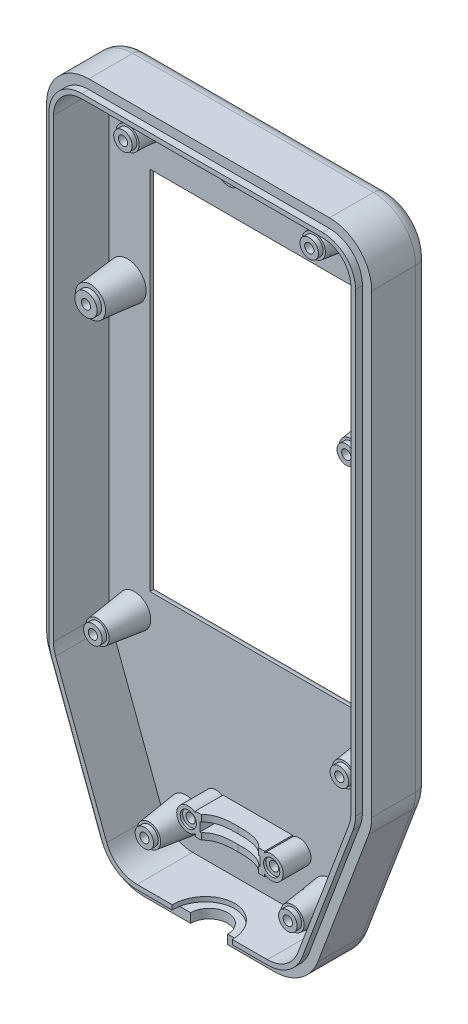
from build123d import *

# Parameters (mm, degrees)
SALIENTE_EXTRUIR1_DEPTH  = 12.5
CORTAR_EXTRUIR5_DEPTH    = 8
REDONDEO1_R              = 3
SALIENTE_EXTRUIR3_DEPTH  = 1.5
CORTAR_EXTRUIR27_DEPTH   = 12
CROQUIS70_R              = 3.5
CORTAR_EXTRUIR28_DEPTH   = 1
CROQUIS71_R              = 1.5
CORTAR_EXTRUIR29_DEPTH   = 5
CROQUIS72_R              = 5
CORTAR_EXTRUIR30_DEPTH   = 0.4
CROQUIS73_W              = 44
CROQUIS73_H              = 79
CORTAR_EXTRUIR31_DEPTH   = 105.505307201
REDONDEO2_R              = 2
CROQUIS78_R              = 2.5
CROQUIS74_3_R            = 3.5
CROQUIS79_R              = 2
SALIENTE_EXTRUIR5_DEPTH  = 1
CROQUIS80_R              = 1
CORTAR_EXTRUIR33_DEPTH   = 10
CROQUIS87_R              = 2
SALIENTE_EXTRUIR7_DEPTH  = 1
CROQUIS88_R              = 1
CORTAR_EXTRUIR35_DEPTH   = 10
CROQUIS89_R              = 2.5
CROQUIS74_6_R            = 3.5
CROQUIS90_R              = 2
SALIENTE_EXTRUIR8_DEPTH  = 1
CROQUIS92_R              = 1
CORTAR_EXTRUIR36_DEPTH   = 10
CROQUIS95_R              = 2.4
SALIENTE_EXTRUIR9_DEPTH  = 1
CROQUIS96_R              = 1
CORTAR_EXTRUIR37_DEPTH   = 10
CROQUIS97_R              = 4
CORTAR_EXTRUIR38_DEPTH   = 2
CROQUIS98_RX             = 7
CROQUIS98_RY             = 6.5
CORTAR_EXTRUIR39_DEPTH   = 2
CROQUIS99_W              = 7.5
CROQUIS99_H              = 4.8
SALIENTE_EXTRUIR10_DEPTH = 6
CROQUIS100_W             = 13
CROQUIS100_H             = 2
CORTAR_EXTRUIR40_DEPTH   = 6
CORTAR_EXTRUIR41_DEPTH   = 6
CROQUIS103_R             = 2.5
SALIENTE_EXTRUIR11_DEPTH = 6
CROQUIS104_R             = 1.75
CORTAR_EXTRUIR42_DEPTH   = 0.5
CROQUIS105_R             = 1
CORTAR_EXTRUIR43_DEPTH   = 6
CROQUIS108_R             = 2
SALIENTE_EXTRUIR12_DEPTH = 1
CROQUIS109_R             = 1
CORTAR_EXTRUIR44_DEPTH   = 10
CROQUIS112_R             = 2
SALIENTE_EXTRUIR13_DEPTH = 1
CROQUIS113_R             = 1
CORTAR_EXTRUIR45_DEPTH   = 10
CROQUIS117_R             = 1.5
CORTAR_EXTRUIR46_DEPTH   = 10
CROQUIS120_R             = 2
SALIENTE_EXTRUIR14_DEPTH = 1
CROQUIS122_R             = 1
CORTAR_EXTRUIR47_DEPTH   = 10
CROQUIS118_3_R           = 3.5
CROQUIS123_R             = 2.5
CROQUIS124_R             = 2
SALIENTE_EXTRUIR15_DEPTH = 1
CROQUIS125_R             = 1
CORTAR_EXTRUIR48_DEPTH   = 10


with BuildPart() as part:
    # Croquis1 → Saliente-Extruir1 (new body)
    with BuildSketch(Plane.XY):
        with BuildLine():
            Line((-22.155928994, 95.954885102), (29.844071006, 95.954885102))
            ThreePointArc((29.844071006, 95.954885102), (36.29125523, 93.284373958), (38.961766375, 86.837189734))
            Line((38.961766375, 86.837189734), (38.961766375, -11.692810266))
            ThreePointArc((38.961766375, -11.692810266), (38.800517726, -13.481377247), (38.321972006, -15.212263426))
            Line((38.321972006, -15.212263426), (27.285455785, -44.564568057))
            ThreePointArc((27.285455785, -44.564568057), (23.617590112, -49.266870537), (17.925250154, -51.045114898))
            Line((17.925250154, -51.045114898), (-10.229579438, -51.045114898))
            ThreePointArc((-10.229579438, -51.045114898), (-15.920892374, -49.267581503), (-19.588905549, -44.566906311))
            Line((-19.588905549, -44.566906311), (-30.632950472, -15.216838151))
            ThreePointArc((-30.632950472, -15.216838151), (-31.112152227, -13.484842661), (-31.273624362, -11.695046738))
            Line((-31.273624362, -11.695046738), (-31.273624362, 86.837189734))
            ThreePointArc((-31.273624362, 86.837189734), (-28.603113217, 93.284373958), (-22.155928994, 95.954885102))
        make_face()
    extrude(amount=SALIENTE_EXTRUIR1_DEPTH)

    # Croquis7 → Cortar-Extruir5 (cut)
    with BuildSketch(Plane.XY.offset(12.5)):
        with BuildLine():
            Line((29.844071006, 92.954885102), (-22.155928994, 92.954885102))
            ThreePointArc((-22.155928994, 92.954885102), (-26.481792874, 91.163053614), (-28.273624362, 86.837189734))
            Line((-28.273624362, 86.837189734), (-28.273624362, -11.695046738))
            ThreePointArc((-28.273624362, -11.695046738), (-28.160593868, -12.947903884), (-27.825152639, -14.160300727))
            Line((-27.825152639, -14.160300727), (-16.781107715, -43.510368887))
            ThreePointArc((-16.781107715, -43.510368887), (-14.213498493, -46.800841521), (-10.229579438, -48.045114898))
            Line((-10.229579438, -48.045114898), (17.925250154, -48.045114898))
            ThreePointArc((17.925250154, -48.045114898), (21.909888125, -46.800343846), (24.477394096, -43.508732109))
            Line((24.477394096, -43.508732109), (35.513910316, -14.156427478))
            ThreePointArc((35.513910316, -14.156427478), (35.848892321, -12.944807153), (35.961766375, -11.692810266))
            Line((35.961766375, -11.692810266), (35.961766375, 86.837189734))
            ThreePointArc((35.961766375, 86.837189734), (34.169934886, 91.163053614), (29.844071006, 92.954885102))
        make_face()
    extrude(amount=-CORTAR_EXTRUIR5_DEPTH, mode=Mode.SUBTRACT)

    # Redondeo1
    redondeo1_edges = [part.edges().sort_by_distance(p)[0] for p in [
        (-28.603113217, 93.284373958, 0),
        (-31.273624362, 37.571071498, 0),
        (-31.112152227, -13.484842661, 0),
        (-25.110928011, -29.891872231, 0),
        (-15.920892374, -49.267581503, 0),
        (3.847835358, -51.045114898, 0),
        (23.617590112, -49.266870537, 0),
        (32.803713895, -29.888415741, 0),
        (38.800517726, -13.481377247, 0),
        (38.961766375, 37.572189734, 0),
        (36.29125523, 93.284373958, 0),
        (3.844071006, 95.954885102, 0),
    ]]
    fillet(redondeo1_edges, radius=REDONDEO1_R)

    # Croquis67 → Saliente-Extruir3 (add)
    with BuildSketch(Plane.XY.offset(12.5)):
        with BuildLine():
            Line((29.844071006, 93.954885102), (-22.155928994, 93.954885102))
            ThreePointArc((-22.155928994, 93.954885102), (-27.188899655, 91.870160395), (-29.273624362, 86.837189734))
            Line((-29.273624362, 86.837189734), (-29.273624362, -11.695046738))
            ThreePointArc((-29.273624362, -11.695046738), (-29.144446654, -13.126883476), (-28.76108525, -14.512479868))
            Line((-28.76108525, -14.512479868), (-17.717040326, -43.862548028))
            ThreePointArc((-17.717040326, -43.862548028), (-14.782629787, -47.623088182), (-10.229579438, -49.045114898))
            Line((-10.229579438, -49.045114898), (17.925250154, -49.045114898))
            ThreePointArc((17.925250154, -49.045114898), (22.479122121, -47.622519409), (25.413414659, -43.860677425))
            Line((25.413414659, -43.860677425), (36.449930879, -14.508372794))
            ThreePointArc((36.449930879, -14.508372794), (36.832767456, -13.123663851), (36.961766375, -11.692810266))
            Line((36.961766375, -11.692810266), (36.961766375, 86.837189734))
            ThreePointArc((36.961766375, 86.837189734), (34.877041668, 91.870160395), (29.844071006, 93.954885102))
        make_face()
    extrude(amount=SALIENTE_EXTRUIR3_DEPTH)

    # Croquis69 → Cortar-Extruir27 (cut)
    with BuildSketch(Plane.XY.offset(14)):
        with BuildLine():
            Line((29.844071006, 92.954885102), (-22.155928994, 92.954885102))
            ThreePointArc((-22.155928994, 92.954885102), (-26.481792874, 91.163053614), (-28.273624362, 86.837189734))
            Line((-28.273624362, 86.837189734), (-28.273624362, -11.695046738))
            ThreePointArc((-28.273624362, -11.695046738), (-28.160593868, -12.947903884), (-27.825152639, -14.160300727))
            Line((-27.825152639, -14.160300727), (-16.781107715, -43.510368887))
            ThreePointArc((-16.781107715, -43.510368887), (-14.213498493, -46.800841521), (-10.229579438, -48.045114898))
            Line((-10.229579438, -48.045114898), (17.925250154, -48.045114898))
            ThreePointArc((17.925250154, -48.045114898), (21.909888125, -46.800343846), (24.477394096, -43.508732109))
            Line((24.477394096, -43.508732109), (35.513910316, -14.156427478))
            ThreePointArc((35.513910316, -14.156427478), (35.848892321, -12.944807153), (35.961766375, -11.692810266))
            Line((35.961766375, -11.692810266), (35.961766375, 86.837189734))
            ThreePointArc((35.961766375, 86.837189734), (34.169934886, 91.163053614), (29.844071006, 92.954885102))
        make_face()
    extrude(amount=-CORTAR_EXTRUIR27_DEPTH, mode=Mode.SUBTRACT)

    # Croquis70 → Cortar-Extruir28 (cut)
    with BuildSketch(Plane(origin=(0, 0, 0), x_dir=(-1, 0, 0), z_dir=(0, 0, -1))):
        with Locations((-2.541766375, 87.954885102)):
            Circle(CROQUIS70_R)
    extrude(amount=-CORTAR_EXTRUIR28_DEPTH, mode=Mode.SUBTRACT)

    # Croquis71 → Cortar-Extruir29 (cut)
    with BuildSketch(Plane(origin=(0, 0, 1), x_dir=(-1, 0, 0), z_dir=(0, 0, -1))):
        with Locations((-2.541766375, 87.954885102)):
            Circle(CROQUIS71_R)
    extrude(amount=-CORTAR_EXTRUIR29_DEPTH, mode=Mode.SUBTRACT)

    # Croquis72 → Cortar-Extruir30 (cut)
    with BuildSketch(Plane(origin=(0, 0, 0), x_dir=(-1, 0, 0), z_dir=(0, 0, -1))):
        with Locations((-2.541766375, 87.954885102)):
            Circle(CROQUIS72_R)
    extrude(amount=-CORTAR_EXTRUIR30_DEPTH, mode=Mode.SUBTRACT)

    # Croquis73 → Cortar-Extruir31 (cut, through all)
    with BuildSketch(Plane(origin=(0, 0, 0), x_dir=(-1, 0, 0), z_dir=(0, 0, -1))):
        with Locations((-2.541766375, 35.654885102)):
            Rectangle(CROQUIS73_W, CROQUIS73_H)
    extrude(amount=-CORTAR_EXTRUIR31_DEPTH, mode=Mode.SUBTRACT)

    # Redondeo2
    redondeo2_edges = [part.edges().sort_by_distance(p)[0] for p in [
        (2.541766375, -3.845114898, 0),
        (-19.458233625, 35.654885102, 0),
        (2.541766375, 75.154885102, 0),
        (24.541766375, 35.654885102, 0),
    ]]
    fillet(redondeo2_edges, radius=REDONDEO2_R - 0.0001)  # a hair under: the kernel refuses the full size

    # Croquis78 → Recubrir10 section 0
    with BuildSketch(Plane.XY.offset(10)):
        with Locations((31.961766375, 51.954885102)):
            Circle(CROQUIS78_R)
    # Croquis74<3> → Recubrir10 section 1
    with BuildSketch(Plane.XY.offset(2)):
        with Locations((31.961766375, 51.954885102)):
            Circle(CROQUIS74_3_R)
    loft()

    # Croquis79 → Saliente-Extruir5 (add)
    with BuildSketch(Plane.XY.offset(10)):
        with Locations((31.961766375, 51.954885102)):
            Circle(CROQUIS79_R)
    extrude(amount=SALIENTE_EXTRUIR5_DEPTH)

    # Croquis80 → Cortar-Extruir33 (cut)
    with BuildSketch(Plane.XY.offset(11)):
        with Locations((31.961766375, 51.954885102)):
            Circle(CROQUIS80_R)
    extrude(amount=-CORTAR_EXTRUIR33_DEPTH, mode=Mode.SUBTRACT)

    # Recubrir12: read off the stored shape, not the designer's step
    # Recubrir12: loft between two sections, ruled curve by curve
    recubrir12_from = [
        Edge.make_bspline([(-13.791157685, -40.264408118, 10), (-11.229744126, -35.970323748, 10), (-6.935659755, -38.531737307, 10), (-9.497073314, -42.825821677, 10), (-12.058486873, -47.119906048, 10), (-16.352571243, -44.558492489, 10), (-13.791157685, -40.264408118, 10)], [0, 0, 0, 0, 0.5, 0.5, 0.5, 1, 1, 1, 1], 3, [1, 0.333333333, 0.333333333, 1, 0.333333333, 0.333333333, 1]),
    ]
    recubrir12_to = [
        Edge.make_bspline([(-14.99961328, -40.549808592, 2), (-13.009000668, -33.83881303, 2), (-6.298005107, -35.829425642, 2), (-8.288617719, -42.540421204, 2), (-10.27923033, -49.251416765, 2), (-16.990225892, -47.260804154, 2), (-14.99961328, -40.549808592, 2)], [0, 0, 0, 0, 0.5, 0.5, 0.5, 1, 1, 1, 1], 3, [1, 0.333333333, 0.333333333, 1, 0.333333333, 0.333333333, 1]),
    ]
    recubrir12 = Solid(Shell([*[Face.make_surface_from_curves(recubrir12_from[k], recubrir12_to[k]) for k in range(1)], Face(Wire(recubrir12_from)), Face(Wire(recubrir12_to))]))
    add(recubrir12)

    # Croquis87 → Saliente-Extruir7 (add)
    with BuildSketch(Plane.XY.offset(10)):
        with Locations((-11.644115499, -41.545114898)):
            Circle(CROQUIS87_R)
    extrude(amount=SALIENTE_EXTRUIR7_DEPTH)

    # Croquis88 → Cortar-Extruir35 (cut)
    with BuildSketch(Plane.XY.offset(11)):
        with Locations((-11.644115499, -41.545114898)):
            Circle(CROQUIS88_R)
    extrude(amount=-CORTAR_EXTRUIR35_DEPTH, mode=Mode.SUBTRACT)

    # Croquis89 → Recubrir13 section 0
    with BuildSketch(Plane.XY.offset(10)):
        with Locations((19.339778204, -41.545114898)):
            Circle(CROQUIS89_R)
    # Croquis74<6> → Recubrir13 section 1
    with BuildSketch(Plane.XY.offset(2)):
        with Locations((19.339778204, -41.545114898)):
            Circle(CROQUIS74_6_R)
    loft()

    # Croquis90 → Saliente-Extruir8 (add)
    with BuildSketch(Plane.XY.offset(10)):
        with Locations((19.339778204, -41.545114898)):
            Circle(CROQUIS90_R)
    extrude(amount=SALIENTE_EXTRUIR8_DEPTH)

    # Croquis92 → Cortar-Extruir36 (cut)
    with BuildSketch(Plane.XY.offset(11)):
        with Locations((19.339778204, -41.545114898)):
            Circle(CROQUIS92_R)
    extrude(amount=-CORTAR_EXTRUIR36_DEPTH, mode=Mode.SUBTRACT)

    # Recubrir14: read off the stored shape, not the designer's step
    # Recubrir14: loft between two sections, ruled curve by curve
    recubrir14_from = [
        Edge.make_bspline([(-22.815157281, 48.230254413, 2), (-15.365895902, 51.147188575, 2), (-18.282830064, 58.596449954, 2), (-25.732091443, 55.679515792, 2), (-33.181352822, 52.762581629, 2), (-30.26441866, 45.31332025, 2), (-22.815157281, 48.230254413, 2)], [0, 0, 0, 0, 0.5, 0.5, 0.5, 1, 1, 1, 1], 3, [1, 0.333333333, 0.333333333, 1, 0.333333333, 0.333333333, 1]),
    ]
    recubrir14_to = [
        Edge.make_bspline([(-22.2293996, 49.428297458, 10), (-17.176224312, 53.516746982, 10), (-21.264673836, 58.56992227, 10), (-26.317849124, 54.481472746, 10), (-31.371024412, 50.393023222, 10), (-27.282574888, 45.339847934, 10), (-22.2293996, 49.428297458, 10)], [0, 0, 0, 0, 0.5, 0.5, 0.5, 1, 1, 1, 1], 3, [1, 0.333333333, 0.333333333, 1, 0.333333333, 0.333333333, 1]),
    ]
    recubrir14 = Solid(Shell([*[Face.make_surface_from_curves(recubrir14_from[k], recubrir14_to[k]) for k in range(1)], Face(Wire(recubrir14_from)), Face(Wire(recubrir14_to))]))
    add(recubrir14)

    # Croquis95 → Saliente-Extruir9 (add)
    with BuildSketch(Plane.XY.offset(10)):
        with Locations((-24.273624362, 51.954885102)):
            Circle(CROQUIS95_R)
    extrude(amount=SALIENTE_EXTRUIR9_DEPTH)

    # Croquis96 → Cortar-Extruir37 (cut)
    with BuildSketch(Plane.XY.offset(11)):
        with Locations((-24.273624362, 51.954885102)):
            Circle(CROQUIS96_R)
    extrude(amount=-CORTAR_EXTRUIR37_DEPTH, mode=Mode.SUBTRACT)

    # Croquis97 → Cortar-Extruir38 (cut)
    with BuildSketch(Plane.XZ.offset(51.045114898)):
        with Locations((3.847835358, 12.5)):
            Circle(CROQUIS97_R)
    extrude(amount=-CORTAR_EXTRUIR38_DEPTH, mode=Mode.SUBTRACT)

    # Croquis98 → Cortar-Extruir39 (cut)
    with BuildSketch(Plane.XZ.offset(49.045114898)):
        with Locations(Location((3.847835358, 14), (0, 0, 90))):
            Ellipse(CROQUIS98_RX, CROQUIS98_RY)
    extrude(amount=-CORTAR_EXTRUIR39_DEPTH, mode=Mode.SUBTRACT)

    # Croquis99 → Saliente-Extruir10 (add)
    with BuildSketch(Plane.XY.offset(2)):
        with Locations((0.094071006, -36.445114898)):
            Rectangle(CROQUIS99_W, CROQUIS99_H)
    saliente_extruir10 = extrude(amount=SALIENTE_EXTRUIR10_DEPTH)

    # Croquis100 → Cortar-Extruir40 (cut)
    with BuildSketch(Plane.XY.offset(8)):
        with Locations((3.844071006, -36.445114898)):
            Rectangle(CROQUIS100_W, CROQUIS100_H)
    cortar_extruir40 = extrude(amount=-CORTAR_EXTRUIR40_DEPTH, mode=Mode.SUBTRACT)

    # Croquis102 → Cortar-Extruir41 (cut)
    with BuildSketch(Plane(origin=(0, -34.045114898, 0), x_dir=(1, 0, 0), z_dir=(0, 1, 0))):
        with BuildLine():
            Line((2.214071006, -8), (-2.361762343, -8))
            add(Edge.make_bspline(
                [(2.214071006, -8), (18.415127829, -9.378576265), (1.49433113, -3.343259679), (-2.361762343, -8)],
                knots=[0, 0, 0, 0, 1, 1, 1, 1], degree=3))
        make_face()
    cortar_extruir41 = extrude(amount=-CORTAR_EXTRUIR41_DEPTH, mode=Mode.SUBTRACT)

    # Croquis103 → Saliente-Extruir11 (add)
    with BuildSketch(Plane.XY.offset(8)):
        with Locations((-5.161762343, -36.333526398)):
            Circle(CROQUIS103_R)
    saliente_extruir11 = extrude(amount=-SALIENTE_EXTRUIR11_DEPTH)

    # Croquis104 → Cortar-Extruir42 (cut)
    with BuildSketch(Plane.XY.offset(8)):
        with Locations((-5.161762343, -36.333526398)):
            Circle(CROQUIS104_R)
    cortar_extruir42 = extrude(amount=-CORTAR_EXTRUIR42_DEPTH, mode=Mode.SUBTRACT)

    # Croquis105 → Cortar-Extruir43 (cut)
    with BuildSketch(Plane.XY.offset(7.5)):
        with Locations((-5.161762343, -36.333526398)):
            Circle(CROQUIS105_R)
    cortar_extruir43 = extrude(amount=-CORTAR_EXTRUIR43_DEPTH, mode=Mode.SUBTRACT)

    # Simetría2: Saliente-Extruir10, Cortar-Extruir40, Cortar-Extruir41, Saliente-Extruir11, Cortar-Extruir42, Cortar-Extruir43 across plane
    add(saliente_extruir10.mirror(Plane(origin=(3.844071006, -34.045114898, 8), x_dir=(0, 0, 1), z_dir=(-1, 0, 0))))
    add(cortar_extruir40.mirror(Plane(origin=(3.844071006, -34.045114898, 8), x_dir=(0, 0, 1), z_dir=(-1, 0, 0))), mode=Mode.SUBTRACT)
    add(cortar_extruir41.mirror(Plane(origin=(3.844071006, -34.045114898, 8), x_dir=(0, 0, 1), z_dir=(-1, 0, 0))), mode=Mode.SUBTRACT)
    add(saliente_extruir11.mirror(Plane(origin=(3.844071006, -34.045114898, 8), x_dir=(0, 0, 1), z_dir=(-1, 0, 0))))
    add(cortar_extruir42.mirror(Plane(origin=(3.844071006, -34.045114898, 8), x_dir=(0, 0, 1), z_dir=(-1, 0, 0))), mode=Mode.SUBTRACT)
    add(cortar_extruir43.mirror(Plane(origin=(3.844071006, -34.045114898, 8), x_dir=(0, 0, 1), z_dir=(-1, 0, 0))), mode=Mode.SUBTRACT)

    # Recubrir15: read off the stored shape, not the designer's step
    # Recubrir15: loft between two sections, ruled curve by curve
    recubrir15_from = [
        Edge.make_bspline([(-20.08948698, -11.291313134, 2), (-15.597090508, -5.923038371, 2), (-20.965365271, -1.430641898, 2), (-25.457761744, -6.798916661, 2), (-29.950158216, -12.167191425, 2), (-24.581883453, -16.659587897, 2), (-20.08948698, -11.291313134, 2)], [0, 0, 0, 0, 0.5, 0.5, 0.5, 1, 1, 1, 1], 3, [1, 0.333333333, 0.333333333, 1, 0.333333333, 0.333333333, 1]),
    ]
    recubrir15_to = [
        Edge.make_bspline([(-20.606730584, -10.291939407, 10), (-18.113081566, -5.958151851, 10), (-22.446869122, -3.464502833, 10), (-24.94051814, -7.798290389, 10), (-27.434167158, -12.132077944, 10), (-23.100379602, -14.625726962, 10), (-20.606730584, -10.291939407, 10)], [0, 0, 0, 0, 0.5, 0.5, 0.5, 1, 1, 1, 1], 3, [1, 0.333333333, 0.333333333, 1, 0.333333333, 0.333333333, 1]),
    ]
    recubrir15 = Solid(Shell([*[Face.make_surface_from_curves(recubrir15_from[k], recubrir15_to[k]) for k in range(1)], Face(Wire(recubrir15_from)), Face(Wire(recubrir15_to))]))
    add(recubrir15)

    # Croquis108 → Saliente-Extruir12 (add)
    with BuildSketch(Plane.XY.offset(10)):
        with Locations((-22.773624362, -9.045114898)):
            Circle(CROQUIS108_R)
    extrude(amount=SALIENTE_EXTRUIR12_DEPTH)

    # Croquis109 → Cortar-Extruir44 (cut)
    with BuildSketch(Plane.XY.offset(11)):
        with Locations((-22.773624362, -9.045114898)):
            Circle(CROQUIS109_R)
    extrude(amount=-CORTAR_EXTRUIR44_DEPTH, mode=Mode.SUBTRACT)

    # Recubrir16: read off the stored shape, not the designer's step
    # Recubrir16: loft between two sections, ruled curve by curve
    recubrir16_from = [
        Edge.make_bspline([(27.796065593, -11.313162372, 2), (32.332160541, -16.644563935, 2), (37.663562104, -12.108468987, 2), (33.127467156, -6.777067424, 2), (28.591372209, -1.445665861, 2), (23.259970645, -5.981760809, 2), (27.796065593, -11.313162372, 2)], [0, 0, 0, 0, 0.5, 0.5, 0.5, 1, 1, 1, 1], 3, [1, 0.333333333, 0.333333333, 1, 0.333333333, 0.333333333, 1]),
    ]
    recubrir16_to = [
        Edge.make_bspline([(28.135886195, -9.961783534, 10), (29.969223467, -14.613543894, 10), (34.620983827, -12.780206621, 10), (32.787646554, -8.128446262, 10), (30.954309282, -3.476685902, 10), (26.302548922, -5.310023174, 10), (28.135886195, -9.961783534, 10)], [0, 0, 0, 0, 0.5, 0.5, 0.5, 1, 1, 1, 1], 3, [1, 0.333333333, 0.333333333, 1, 0.333333333, 0.333333333, 1]),
    ]
    recubrir16 = Solid(Shell([*[Face.make_surface_from_curves(recubrir16_from[k], recubrir16_to[k]) for k in range(1)], Face(Wire(recubrir16_from)), Face(Wire(recubrir16_to))]))
    add(recubrir16)

    # Croquis112 → Saliente-Extruir13 (add)
    with BuildSketch(Plane.XY.offset(10)):
        with Locations((30.461766375, -9.045114898)):
            Circle(CROQUIS112_R)
    extrude(amount=SALIENTE_EXTRUIR13_DEPTH)

    # Croquis113 → Cortar-Extruir45 (cut)
    with BuildSketch(Plane.XY.offset(11)):
        with Locations((30.461766375, -9.045114898)):
            Circle(CROQUIS113_R)
    extrude(amount=-CORTAR_EXTRUIR45_DEPTH, mode=Mode.SUBTRACT)

    # Recubrir17: read off the stored shape, not the designer's step
    # Recubrir17: loft between two sections, ruled curve by curve
    recubrir17_from = [
        Edge.make_bspline([(0.241801979, 88.934764573, 7), (2.20156092, 93.534693365, 7), (6.801489712, 91.574934424, 7), (4.841730771, 86.975005632, 7), (2.881971829, 82.375076839, 7), (-1.717956963, 84.334835781, 7), (0.241801979, 88.934764573, 7)], [0, 0, 0, 0, 0.5, 0.5, 0.5, 1, 1, 1, 1], 3, [1, 0.333333333, 0.333333333, 1, 0.333333333, 0.333333333, 1]),
    ]
    recubrir17_to = [
        Edge.make_bspline([(-0.958205221, 87.968985937, 0), (-0.930003552, 94.968929127, 0), (6.069939638, 94.940727458, 0), (6.04173797, 87.940784268, 0), (6.013536301, 80.940841078, 0), (-0.986406889, 80.969042746, 0), (-0.958205221, 87.968985937, 0)], [0, 0, 0, 0, 0.5, 0.5, 0.5, 1, 1, 1, 1], 3, [1, 0.333333333, 0.333333333, 1, 0.333333333, 0.333333333, 1]),
    ]
    recubrir17 = Solid(Shell([*[Face.make_surface_from_curves(recubrir17_from[k], recubrir17_to[k]) for k in range(1)], Face(Wire(recubrir17_from)), Face(Wire(recubrir17_to))]))
    add(recubrir17)

    # Recubrir17 2: loft between two sections, ruled curve by curve
    recubrir17_2_from = [
        Edge.make_bspline([(0.241801979, 88.934764573, 7), (2.20156092, 93.534693365, 7), (6.801489712, 91.574934424, 7), (4.841730771, 86.975005632, 7), (2.881971829, 82.375076839, 7), (-1.717956963, 84.334835781, 7), (0.241801979, 88.934764573, 7)], [0, 0, 0, 0, 0.5, 0.5, 0.5, 1, 1, 1, 1], 3, [1, 0.333333333, 0.333333333, 1, 0.333333333, 0.333333333, 1]),
    ]
    recubrir17_2_to = [
        Edge.make_bspline([(-0.958205221, 87.968985937, 0), (-0.930003552, 94.968929127, 0), (6.069939638, 94.940727458, 0), (6.04173797, 87.940784268, 0), (6.013536301, 80.940841078, 0), (-0.986406889, 80.969042746, 0), (-0.958205221, 87.968985937, 0)], [0, 0, 0, 0, 0.5, 0.5, 0.5, 1, 1, 1, 1], 3, [1, 0.333333333, 0.333333333, 1, 0.333333333, 0.333333333, 1]),
    ]
    recubrir17_2 = Solid(Shell([*[Face.make_surface_from_curves(recubrir17_2_from[k], recubrir17_2_to[k]) for k in range(1)], Face(Wire(recubrir17_2_from)), Face(Wire(recubrir17_2_to))]))
    add(recubrir17_2)

    # Croquis117 → Cortar-Extruir46 (cut)
    with BuildSketch(Plane.XY.offset(7)):
        with Locations((2.541766375, 87.954885102)):
            Circle(CROQUIS117_R)
    extrude(amount=-CORTAR_EXTRUIR46_DEPTH, mode=Mode.SUBTRACT)

    # Recubrir18: read off the stored shape, not the designer's step
    # Recubrir18: loft between two sections, ruled curve by curve
    recubrir18_from = [
        Edge.make_bspline([(-18.61774061, 87.443860945, 10), (-16.879788925, 92.132093441, 10), (-12.191556429, 90.394141756, 10), (-13.929508114, 85.70590926, 10), (-15.667459799, 81.017676763, 10), (-20.355692295, 82.755628448, 10), (-18.61774061, 87.443860945, 10)], [0, 0, 0, 0, 0.5, 0.5, 0.5, 1, 1, 1, 1], 3, [1, 0.333333333, 0.333333333, 1, 0.333333333, 0.333333333, 1]),
    ]
    recubrir18_to = [
        Edge.make_bspline([(-17.693112505, 89.498505018, 2), (-11.845872674, 92.337481304, 2), (-9.006896387, 86.490241473, 2), (-14.854136219, 83.651265187, 2), (-20.70137605, 80.8122889, 2), (-23.540352337, 86.659528732, 2), (-17.693112505, 89.498505018, 2)], [0, 0, 0, 0, 0.5, 0.5, 0.5, 1, 1, 1, 1], 3, [1, 0.333333333, 0.333333333, 1, 0.333333333, 0.333333333, 1]),
    ]
    recubrir18 = Solid(Shell([*[Face.make_surface_from_curves(recubrir18_from[k], recubrir18_to[k]) for k in range(1)], Face(Wire(recubrir18_from)), Face(Wire(recubrir18_to))]))
    add(recubrir18)

    # Croquis120 → Saliente-Extruir14 (add)
    with BuildSketch(Plane.XY.offset(10)):
        with Locations((-16.273624362, 86.574885102)):
            Circle(CROQUIS120_R)
    extrude(amount=SALIENTE_EXTRUIR14_DEPTH)

    # Croquis122 → Cortar-Extruir47 (cut)
    with BuildSketch(Plane.XY.offset(11)):
        with Locations((-16.273624362, 86.574885102)):
            Circle(CROQUIS122_R)
    extrude(amount=-CORTAR_EXTRUIR47_DEPTH, mode=Mode.SUBTRACT)

    # Croquis118<3> → Recubrir19 section 0
    with BuildSketch(Plane.XY.offset(2)):
        with Locations((23.961766375, 86.574885102)):
            Circle(CROQUIS118_3_R)
    # Croquis123 → Recubrir19 section 1
    with BuildSketch(Plane.XY.offset(10)):
        with Locations((23.961766375, 86.574885102)):
            Circle(CROQUIS123_R)
    loft()

    # Croquis124 → Saliente-Extruir15 (add)
    with BuildSketch(Plane.XY.offset(10)):
        with Locations((23.961766375, 86.574885102)):
            Circle(CROQUIS124_R)
    extrude(amount=SALIENTE_EXTRUIR15_DEPTH)

    # Croquis125 → Cortar-Extruir48 (cut)
    with BuildSketch(Plane.XY.offset(11)):
        with Locations((23.961766375, 86.574885102)):
            Circle(CROQUIS125_R)
    extrude(amount=-CORTAR_EXTRUIR48_DEPTH, mode=Mode.SUBTRACT)


solid = part.part
